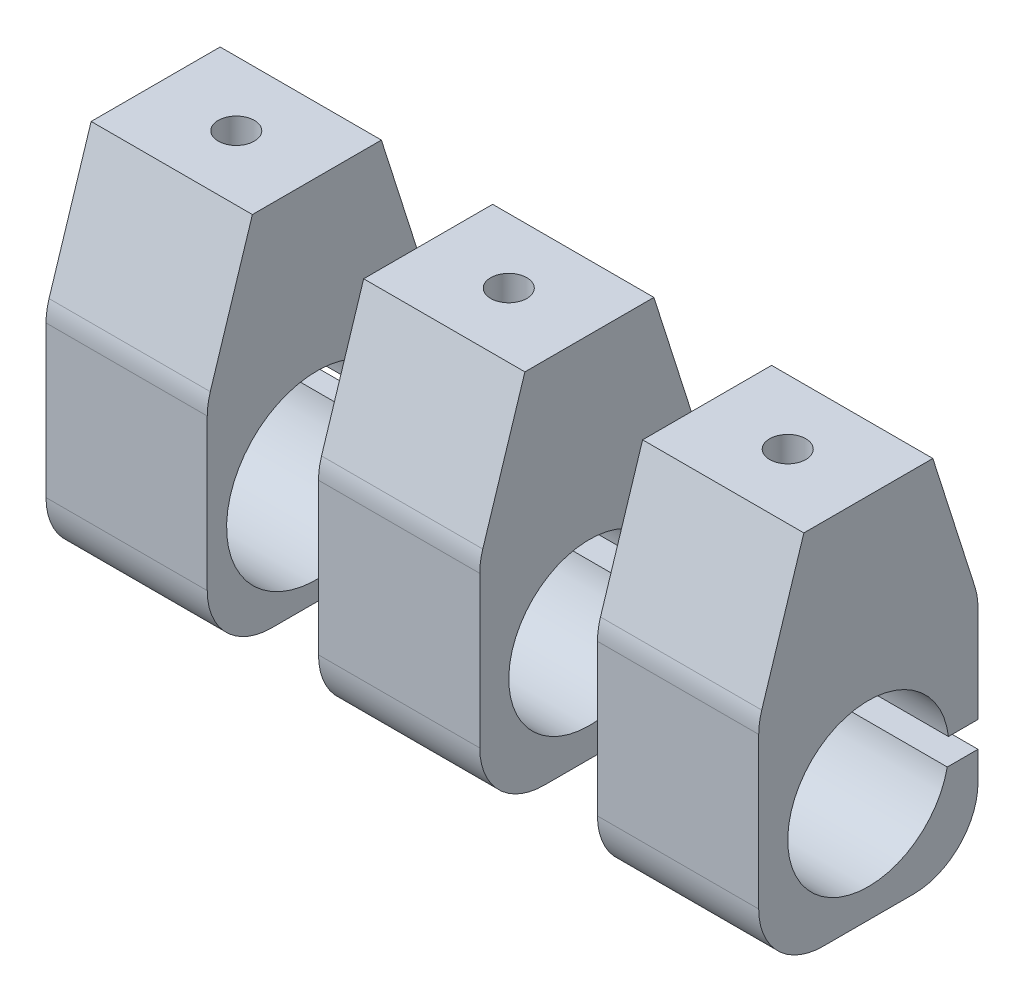
from build123d import *

# Parameters (mm, degrees)
ZOOM_LENSE_MOUNT_DEPTH = 25
SPEC_START             = 42.25
SPEC_MOUNT1_DEPTH      = 25
SPEC_START_2           = 85.5
SPEC_MOUNT_2_DEPTH     = 25
FILLET1_R              = 10
FILLET2_R              = 10
FILLET3_R              = 10
SKETCH2_R              = 2.8
CUT_EXTRUDE1_DEPTH     = 30
SKETCH3_R              = 2.8
CUT_EXTRUDE2_DEPTH     = 30
SKETCH4_R              = 2.8
CUT_EXTRUDE3_DEPTH     = 30


with BuildPart() as part:
    # Sketch1 → zoom lense mount (new body)
    with BuildSketch(Plane(origin=(0, 0, 0), x_dir=(0, 0, -1), z_dir=(1, 0, 0))):
        with BuildLine():
            Line((10, 40), (-10, 40))
            Line((-10, 40), (-17, 18))
            Line((-17, 18), (-17, -17))
            Line((-17, -17), (17, -17))
            Line((17, -17), (17, -2.55))
            Line((17, -2.55), (13.765809094, -2.55))
            ThreePointArc((13.765809094, -2.55), (-13.988966644, 0.555708769), (13.924708255, 1.45))
            Line((13.924708255, 1.45), (17, 1.45))
            Line((17, 1.45), (17, 18))
            Line((17, 18), (10, 40))
        make_face()
    extrude(amount=ZOOM_LENSE_MOUNT_DEPTH)

    # Fillet1
    fillet1_edges = [part.edges().sort_by_distance(p)[0] for p in [
        (12.5, -17, -17),
        (12.5, 18, -17),
        (12.5, -17, 17),
        (12.5, 18, 17),
    ]]
    fillet(fillet1_edges, radius=FILLET1_R)

    # Sketch4 → Cut-Extrude3 (cut)
    with BuildSketch(Plane(origin=(0, 40, 0), x_dir=(1, 0, 0), z_dir=(0, 1, 0))):
        with Locations((12.5, 0)):
            Circle(SKETCH4_R)
    extrude(amount=-CUT_EXTRUDE3_DEPTH, mode=Mode.SUBTRACT)


with BuildPart() as body_2:
    # Sketch1<4> → spec mount1 (new body)
    with BuildSketch(Plane(origin=(0, 0, 0), x_dir=(0, 0, -1), z_dir=(1, 0, 0)).offset(SPEC_START)):
        with BuildLine():
            Line((10, 40), (-10, 40))
            Line((-10, 40), (-17, 18))
            Line((-17, 18), (-17, -17))
            Line((-17, -17), (17, -17))
            Line((17, -17), (17, -2.55))
            Line((17, -2.55), (12.237136103, -2.55))
            ThreePointArc((12.237136103, -2.55), (-12.487575277, 0.55719269), (12.415615168, 1.45))
            Line((12.415615168, 1.45), (17, 1.45))
            Line((17, 1.45), (17, 18))
            Line((17, 18), (10, 40))
        make_face()
    extrude(amount=SPEC_MOUNT1_DEPTH)

    # Fillet2
    fillet2_edges = [body_2.edges().sort_by_distance(p)[0] for p in [
        (54.75, -17, -17),
        (54.75, 18, -17),
        (54.75, -17, 17),
        (54.75, 18, 17),
    ]]
    fillet(fillet2_edges, radius=FILLET2_R)

    # Sketch3 → Cut-Extrude2 (cut)
    with BuildSketch(Plane(origin=(0, 40, 0), x_dir=(1, 0, 0), z_dir=(0, 1, 0))):
        with Locations((54.75, 0)):
            Circle(SKETCH3_R)
    extrude(amount=-CUT_EXTRUDE2_DEPTH, mode=Mode.SUBTRACT)


with BuildPart() as body_3:
    # Sketch1<5> → spec mount 2 (new body)
    with BuildSketch(Plane(origin=(0, 0, 0), x_dir=(0, 0, -1), z_dir=(1, 0, 0)).offset(SPEC_START_2)):
        with BuildLine():
            Line((10, 40), (-10, 40))
            Line((-10, 40), (-17, 18))
            Line((-17, 18), (-17, -17))
            Line((-17, -17), (17, -17))
            Line((17, -17), (17, -2.55))
            Line((17, -2.55), (12.237136103, -2.55))
            ThreePointArc((12.237136103, -2.55), (-12.487575277, 0.55719269), (12.415615168, 1.45))
            Line((12.415615168, 1.45), (17, 1.45))
            Line((17, 1.45), (17, 18))
            Line((17, 18), (10, 40))
        make_face()
    extrude(amount=SPEC_MOUNT_2_DEPTH)

    # Fillet3
    fillet3_edges = [body_3.edges().sort_by_distance(p)[0] for p in [
        (98, -17, -17),
        (98, 18, -17),
        (98, -17, 17),
        (98, 18, 17),
    ]]
    fillet(fillet3_edges, radius=FILLET3_R)

    # Sketch2 → Cut-Extrude1 (cut)
    with BuildSketch(Plane(origin=(0, 40, 0), x_dir=(1, 0, 0), z_dir=(0, 1, 0))):
        with Locations((98, 0)):
            Circle(SKETCH2_R)
    extrude(amount=-CUT_EXTRUDE1_DEPTH, mode=Mode.SUBTRACT)


solid = Compound([part.part, body_2.part, body_3.part])
